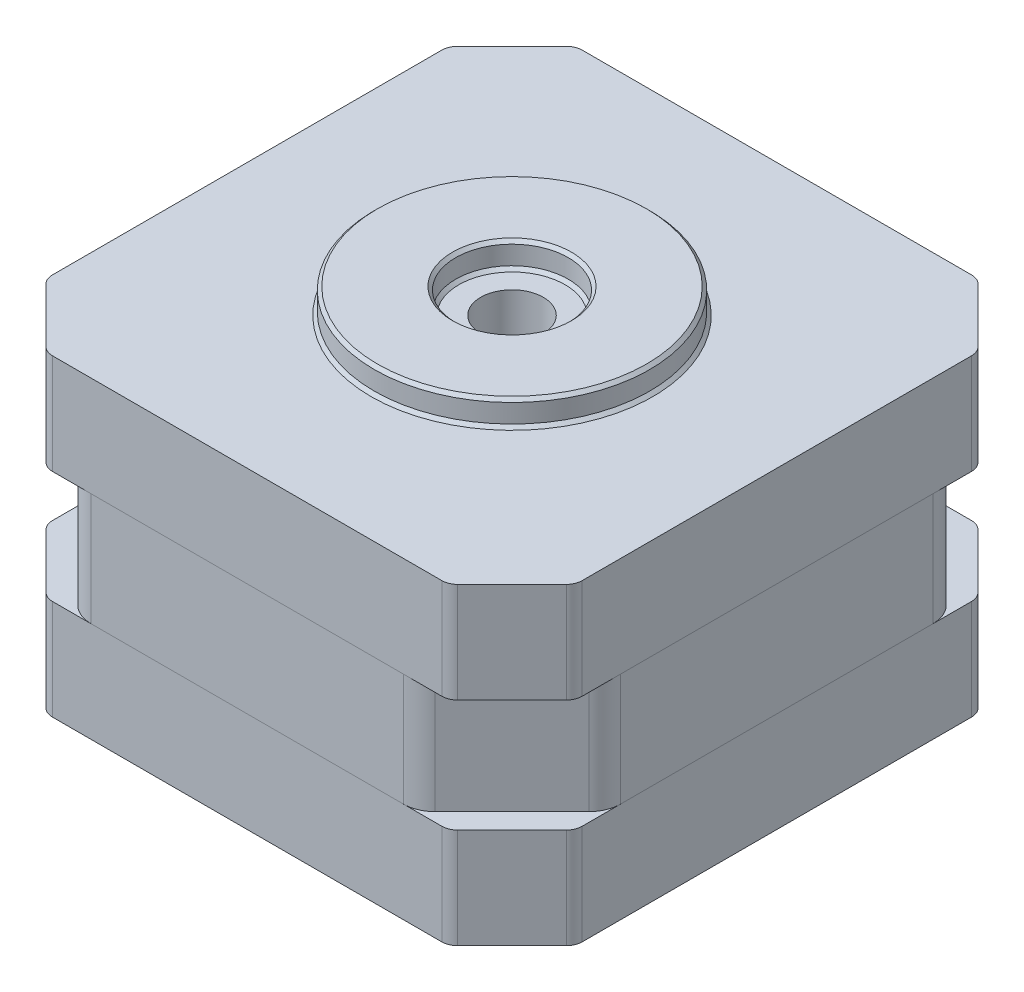
from build123d import *

# Parameters (mm, degrees)
SKETCH1_W           = 42.3
SKETCH1_H           = 42.3
BOSS_EXTRUDE1_DEPTH = 8.001
CHAMFER1_SIZE       = 5.08
SKETCH2_W           = 42.3
SKETCH2_H           = 42.3
BOSS_EXTRUDE2_DEPTH = 8.9916
CHAMFER3_SIZE       = 7.62
FILLET1_R           = 2.54
FILLET2_R           = 1.27
SKETCH3_W           = 42.3
SKETCH3_H           = 42.3
BOSS_EXTRUDE3_DEPTH = 8.001
CHAMFER4_SIZE       = 5.08
FILLET3_R           = 1.27
SKETCH4_R           = 10.9982
SKETCH4_R_2         = 4.4958
BOSS_EXTRUDE4_DEPTH = 2
CHAMFER5_SIZE       = 0.254
SKETCH5_R           = 2.5019
CUT_EXTRUDE1_DEPTH  = 12.7


with BuildPart() as part:
    # Sketch1 → Boss-Extrude1 (new body)
    with BuildSketch(Plane(origin=(0, 0, 0), x_dir=(1, 0, 0), z_dir=(0, 1, 0))):
        Rectangle(SKETCH1_W, SKETCH1_H)
    extrude(amount=BOSS_EXTRUDE1_DEPTH)

    # Chamfer1
    chamfer1_edges = [part.edges().sort_by_distance(p)[0] for p in [
        (-21.15, 4.0005, 21.15),
        (-21.15, 4.0005, -21.15),
        (21.15, 4.0005, -21.15),
        (21.15, 4.0005, 21.15),
    ]]
    chamfer(chamfer1_edges, length=CHAMFER1_SIZE)

    # Fillet2
    fillet2_edges = [part.edges().sort_by_distance(p)[0] for p in [
        (-21.15, 4.0005, -16.07),
        (-16.07, 4.0005, -21.15),
        (16.07, 4.0005, -21.15),
        (21.15, 4.0005, -16.07),
        (21.15, 4.0005, 16.07),
        (16.07, 4.0005, 21.15),
        (-16.07, 4.0005, 21.15),
        (-21.15, 4.0005, 16.07),
    ]]
    fillet(fillet2_edges, radius=FILLET2_R)


with BuildPart() as body_2:
    # Sketch2 → Boss-Extrude2 (new body)
    with BuildSketch(Plane(origin=(0, 8.001, 0), x_dir=(1, 0, 0), z_dir=(0, 1, 0))):
        Rectangle(SKETCH2_W, SKETCH2_H)
    extrude(amount=BOSS_EXTRUDE2_DEPTH)

    # Chamfer3
    chamfer3_edges = [body_2.edges().sort_by_distance(p)[0] for p in [
        (-21.15, 12.4968, -21.15),
        (-21.15, 12.4968, 21.15),
        (21.15, 12.4968, 21.15),
        (21.15, 12.4968, -21.15),
    ]]
    chamfer(chamfer3_edges, length=CHAMFER3_SIZE)

    # Fillet1
    fillet1_edges = [body_2.edges().sort_by_distance(p)[0] for p in [
        (-21.15, 12.4968, -13.53),
        (-13.53, 12.4968, -21.15),
        (13.53, 12.4968, -21.15),
        (21.15, 12.4968, -13.53),
        (21.15, 12.4968, 13.53),
        (13.53, 12.4968, 21.15),
        (-13.53, 12.4968, 21.15),
        (-21.15, 12.4968, 13.53),
    ]]
    fillet(fillet1_edges, radius=FILLET1_R)


with BuildPart() as body_3:
    # Sketch3 → Boss-Extrude3 (new body)
    with BuildSketch(Plane(origin=(0, 16.9926, 0), x_dir=(1, 0, 0), z_dir=(0, 1, 0))):
        Rectangle(SKETCH3_W, SKETCH3_H)
    extrude(amount=BOSS_EXTRUDE3_DEPTH)

    # Chamfer4
    chamfer4_edges = [body_3.edges().sort_by_distance(p)[0] for p in [
        (-21.15, 20.9931, 21.15),
        (-21.15, 20.9931, -21.15),
        (21.15, 20.9931, -21.15),
        (21.15, 20.9931, 21.15),
    ]]
    chamfer(chamfer4_edges, length=CHAMFER4_SIZE)

    # Fillet3
    fillet3_edges = [body_3.edges().sort_by_distance(p)[0] for p in [
        (-21.15, 20.9931, -16.07),
        (-16.07, 20.9931, -21.15),
        (16.07, 20.9931, -21.15),
        (21.15, 20.9931, -16.07),
        (21.15, 20.9931, 16.07),
        (16.07, 20.9931, 21.15),
        (-16.07, 20.9931, 21.15),
        (-21.15, 20.9931, 16.07),
    ]]
    fillet(fillet3_edges, radius=FILLET3_R)

    # Sketch4 → Boss-Extrude4 (add)
    with BuildSketch(Plane(origin=(0, 24.9936, 0), x_dir=(1, 0, 0), z_dir=(0, 1, 0))):
        Circle(SKETCH4_R)
        Circle(SKETCH4_R_2, mode=Mode.SUBTRACT)
    extrude(amount=BOSS_EXTRUDE4_DEPTH)

    # Chamfer5
    chamfer5_edges = [body_3.edges().sort_by_distance(p)[0] for p in [
        (-10.9982, 26.9936, 0),
        (-10.9982, 24.9936, 0),
        (-4.4958, 24.9936, 0),
        (-4.4958, 26.9936, 0),
    ]]
    chamfer(chamfer5_edges, length=CHAMFER5_SIZE)


with BuildPart() as cut_extrude1_tool:
    # Sketch5 → Cut-Extrude1 (new body)
    with BuildSketch(Plane(origin=(0, 24.9936, 0), x_dir=(1, 0, 0), z_dir=(0, 1, 0))):
        Circle(SKETCH5_R)
    extrude(amount=-CUT_EXTRUDE1_DEPTH)


with BuildPart() as body_2_1:
    add(body_2.part)

    # Cut-Extrude1: cut by cut_extrude1_tool
    add(cut_extrude1_tool.part, mode=Mode.SUBTRACT)


with BuildPart() as body_3_1:
    add(body_3.part)

    # Cut-Extrude1: cut by cut_extrude1_tool
    add(cut_extrude1_tool.part, mode=Mode.SUBTRACT)


solid = Compound([part.part, body_2_1.part, body_3_1.part])
